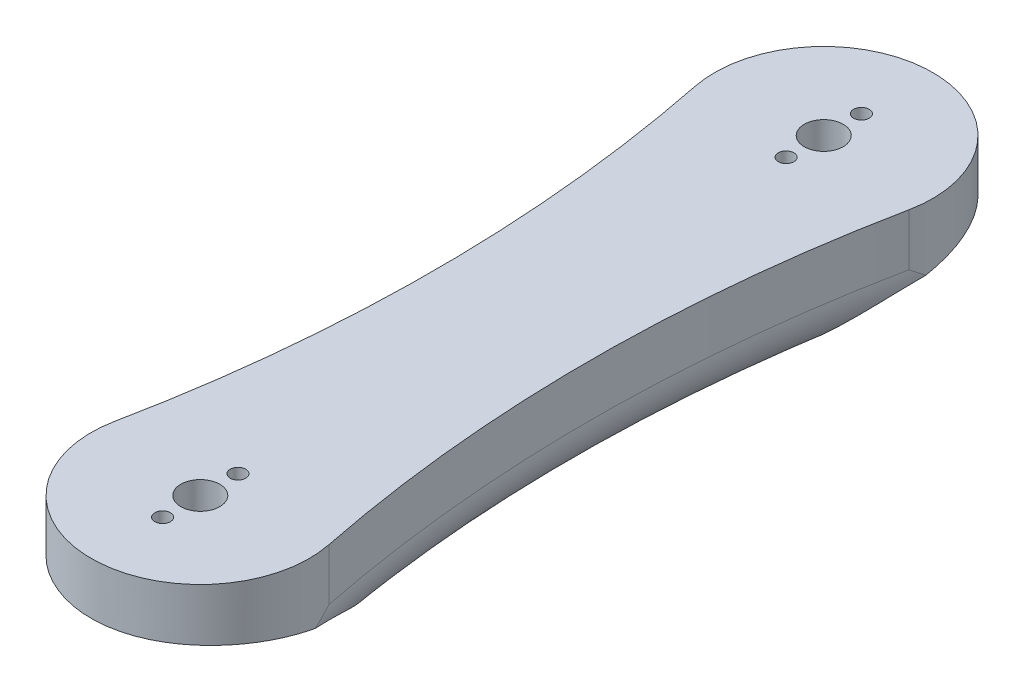
from build123d import *

# Parameters (mm, degrees)
EXTRUDE_1_DEPTH          = 16
SKETCH_1_3_R             = 21
EXTRUDE_2_DEPTH          = 21
CUT_EXTRUDE_1_DEPTH      = 145.093719502
CUT_EXTRUDE_1_DEPTH_BACK = 145.093719502
FILLET_1_R               = 11
EXTRUDE_3_DEPTH          = 6
SKETCH_4_R               = 5.75
CUT_EXTRUDE_2_DEPTH      = 124
SKETCH_6_R               = 18
CUT_EXTRUDE_4_DEPTH      = 21
SKETCH_7_R               = 3.75
SKETCH_7_R_2             = 1.5
CUT_EXTRUDE_5_DEPTH      = 144.342247909


with BuildPart() as part:
    # 草图1 → 凸台-拉伸1 (new body)
    with BuildSketch(Plane(origin=(0, 0, 0), x_dir=(1, 0, 0), z_dir=(0, 1, 0))):
        with BuildLine():
            ThreePointArc((-20.584158416, 4.158415842), (0, 21), (20.584158416, 4.158415842))
            ThreePointArc((20.584158416, 4.158415842), (15, 60), (20.584158416, 115.841584158))
            ThreePointArc((20.584158416, 115.841584158), (0, 99), (-20.584158416, 115.841584158))
            ThreePointArc((-20.584158416, 115.841584158), (-15, 60), (-20.584158416, 4.158415842))
        make_face()
    extrude(amount=EXTRUDE_1_DEPTH)

    # 草图1<3> → 凸台-拉伸2 (add)
    with BuildSketch(Plane(origin=(0, 0, 0), x_dir=(1, 0, 0), z_dir=(0, 1, 0))):
        with Locations(Location((0, 0, 0), (0, 0, 11.421186275))):
            Circle(SKETCH_1_3_R)
        with Locations(Location((0, 120, 0), (0, 0, 348.578813725))):
            Circle(SKETCH_1_3_R)
    extrude(amount=EXTRUDE_2_DEPTH)

    # 草图2 → 切除-拉伸1 (cut, two sides: drawn at the far end of the back side and taken through both)
    with BuildSketch(Plane(origin=(0, 0, 0), x_dir=(0, 0, -1), z_dir=(1, 0, 0)).offset(-CUT_EXTRUDE_1_DEPTH_BACK)):
        with BuildLine():
            Line((-21, 0), (21, 0))
            add(Edge.make_bspline(
                [(-21, 11), (-13.234322718, 11.089514714), (3.625390457, 9.375662882), (14.361768035, 4.302223278), (21, 0)],
                knots=[0, 0, 0, 0, 0.576072184, 1, 1, 1, 1], degree=3))
            Line((-21, 11), (-21, 0))
        make_face()
        with BuildLine():
            Line((141, 0), (141, 11))
            add(Edge.make_bspline(
                [(141, 11), (118.027574222, 12.331728264), (99, 0)],
                knots=[0, 0, 0, 1, 1, 1], degree=2))
            Line((99, 0), (141, 0))
        make_face()
    extrude(amount=CUT_EXTRUDE_1_DEPTH + CUT_EXTRUDE_1_DEPTH_BACK, mode=Mode.SUBTRACT)

    # 圆角1
    # the kernel refuses this fillet: 11 mm, written as the material it takes off along each edge
    with BuildSketch(Plane(origin=(297, 0, -60), x_dir=(-0.9722198320534028, 0, 0.23406964382861203), z_dir=(0.23406964382861203, 0, 0.9722198320534028))) as fillet_1_piece_1:
        with BuildLine():
            CenterArc((282 + FILLET_1_R, -FILLET_1_R), FILLET_1_R, 90, 90)
            Line((282, -FILLET_1_R), (282, 0))
            Line((282, 0), (282 + FILLET_1_R, 0))
        make_face()
    revolve(axis=Axis((297, 0, -60), (0, -1, 0)), revolution_arc=27.073575635, mode=Mode.SUBTRACT)
    with BuildSketch(Plane(origin=(-297, 0, -60), x_dir=(0.9722198320534022, 0, -0.2340696438286144), z_dir=(-0.2340696438286144, 0, -0.9722198320534022))) as fillet_1_piece_2:
        with BuildLine():
            CenterArc((282 + FILLET_1_R, -FILLET_1_R), FILLET_1_R, 90, 90)
            Line((282 + FILLET_1_R, 0), (282, 0))
            Line((282, 0), (282, -FILLET_1_R))
        make_face()
    revolve(axis=Axis((-297, 0, -60), (0, -1, 0)), revolution_arc=27.073575635, mode=Mode.SUBTRACT)

    # 草图3 → 凸台-拉伸3 (add)
    with BuildSketch(Plane(origin=(0, 15, 0), x_dir=(1, 0, 0), z_dir=(0, 1, 0))):
        with BuildLine():
            ThreePointArc((20.584158416, 115.841584158), (15, 60), (20.584158416, 4.158415842))
            ThreePointArc((20.584158416, 4.158415842), (0, 21), (-20.584158416, 4.158415842))
            ThreePointArc((-20.584158416, 4.158415842), (-15, 60), (-20.584158416, 115.841584158))
            ThreePointArc((-20.584158416, 115.841584158), (0, 99), (20.584158416, 115.841584158))
        make_face()
    extrude(amount=EXTRUDE_3_DEPTH)

    # 草图4 → 切除-拉伸2 (cut)
    with BuildSketch(Plane.XY):
        with Locations(Location((0, 9, 0), (0, 0, 359.933405573))):
            Circle(SKETCH_4_R)
    extrude(amount=-CUT_EXTRUDE_2_DEPTH, mode=Mode.SUBTRACT)

    # 草图6 → 切除-拉伸4 (cut)
    with BuildSketch(Plane(origin=(0, 15, 0), x_dir=(1, 0, 0), z_dir=(0, 1, 0))):
        with Locations(Location((0, 120, 0), (0, 0, 270))):
            Circle(SKETCH_6_R)
        with Locations(Location((0, 0, 0), (0, 0, 270))):
            Circle(SKETCH_6_R)
    extrude(amount=-CUT_EXTRUDE_4_DEPTH, mode=Mode.SUBTRACT)

    # 草图7 → 切除-拉伸5 (cut, through all)
    with BuildSketch(Plane.XZ.offset(-15)):
        with Locations(Location((0, -120, 0), (0, 0, 270))):
            Circle(SKETCH_7_R)
        with Locations(Location((0, -112.75, 0), (0, 0, 270))):
            Circle(SKETCH_7_R_2)
        with Locations(Location((0, -127.25, 0), (0, 0, 270))):
            Circle(SKETCH_7_R_2)
        with Locations(Location((0, 7.25, 0), (0, 0, 90))):
            Circle(SKETCH_7_R_2)
        with Locations(Location((0, -7.25, 0), (0, 0, 90))):
            Circle(SKETCH_7_R_2)
        with Locations(Location((0, 0, 0), (0, 0, 90))):
            Circle(SKETCH_7_R)
    extrude(amount=-CUT_EXTRUDE_5_DEPTH, mode=Mode.SUBTRACT)


solid = part.part
